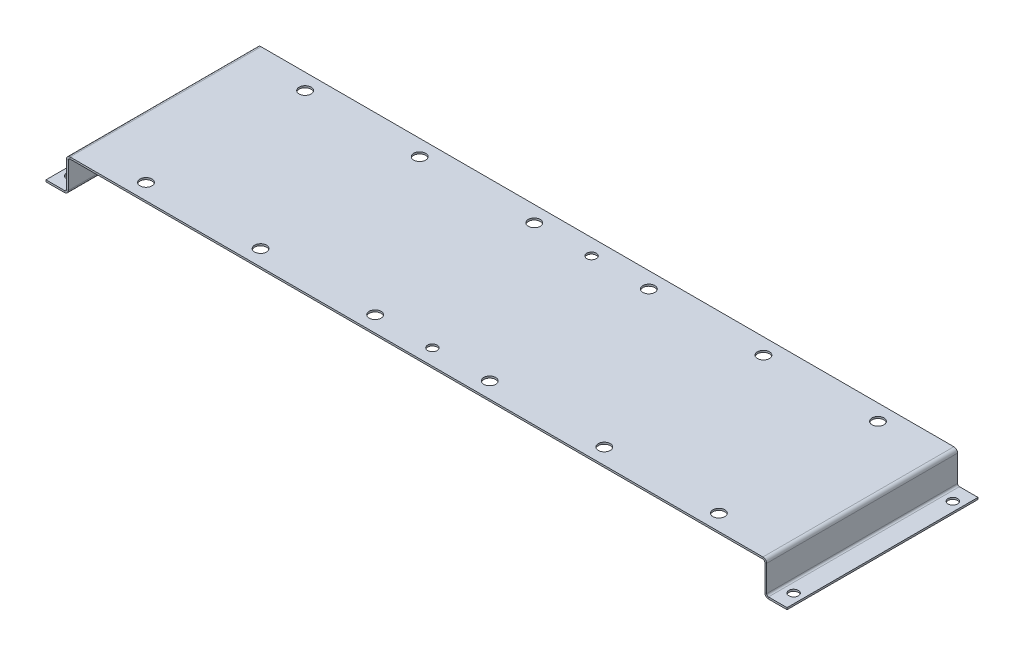
from build123d import *

# Parameters (mm, degrees)
SKETCH1_W                    = 279.4
SKETCH1_H                    = 76.2
BASE_FLANGE1_DEPTH           = 0.7366
EDGE_FLANGE1_STRIP_W         = 4.4196
EDGE_FLANGE1_STRIP_H         = 0.7366
EDGE_FLANGE1_STRIP_CUT_DEPTH = 76.2
EDGE_FLANGE1_DEPTH           = 76.2
EDGE_FLANGE2_DEPTH           = 76.2
F_6_CLEARANCE_HOLE1_D        = 3.7973
LPATTERN1_COUNT              = 6
LPATTERN1_PITCH              = 45.72
LPATTERN1_COUNT_DIR2         = 2
LPATTERN1_PITCH_DIR2         = 63.5
F_6_CLEARANCE_HOLE2_D        = 3.7973


# Sheet-metal steps are written as plain solids
with BuildPart() as part:
    # Sketch1 → Base-Flange1 (new body)
    with BuildSketch(Plane(origin=(0, 0, 0), x_dir=(1, 0, 0), z_dir=(0, 1, 0))):
        with Locations((139.7, 38.1)):
            Rectangle(SKETCH1_W, SKETCH1_H)
    extrude(amount=-BASE_FLANGE1_DEPTH)

    # Edge-Flange1 strip (across the edge) → Edge-Flange1 strip cut (cut)
    with BuildSketch(Plane(origin=(0, -0.7366, 0), x_dir=(1, 0, 0), z_dir=(0, 0, -1))):
        with Locations((-0.7366, -0.3683)):
            Rectangle(EDGE_FLANGE1_STRIP_W, EDGE_FLANGE1_STRIP_H)
    edge_flange1_strip_cut = extrude(amount=EDGE_FLANGE1_STRIP_CUT_DEPTH, mode=Mode.SUBTRACT)

    # Edge-Flange1 section (across the edge) → Edge-Flange1 (add)
    with BuildSketch(Plane(origin=(0, -0.7366, 0), x_dir=(1, 0, 0), z_dir=(0, 0, -1))):
        with BuildLine():
            Line((0, 0.7366), (0, 11.2268))
            Line((0, 11.2268), (0.7366, 11.2268))
            Line((0.7366, 11.2268), (0.7366, 0.7366))
            ThreePointArc((0.7366, 0.7366), (0.952345145, 0.215745145), (1.4732, 0))
            Line((1.4732, 0), (1.4732, -0.7366))
            ThreePointArc((1.4732, -0.7366), (0.43149029, -0.30510971), (0, 0.7366))
        make_face()
    edge_flange1 = extrude(amount=EDGE_FLANGE1_DEPTH)

    # Edge-Flange2 section (across the edge) → Edge-Flange2 (add)
    with BuildSketch(Plane(origin=(0, -12.7, -76.2), x_dir=(0, 1, 0), z_dir=(0, 0, 1))):
        with BuildLine():
            Line((-0.7366, 0.7366), (-0.7366, 8.1534))
            Line((-0.7366, 8.1534), (0, 8.1534))
            Line((0, 8.1534), (0, 0.7366))
            ThreePointArc((0, 0.7366), (0.215745145, 0.215745145), (0.7366, 0))
            Line((0.7366, 0), (0.7366, -0.7366))
            ThreePointArc((0.7366, -0.7366), (-0.30510971, -0.30510971), (-0.7366, 0.7366))
        make_face()
    edge_flange2 = extrude(amount=EDGE_FLANGE2_DEPTH)

    # Sketch21 → 3/32 (0.09375) Diameter Hole1 (revolve, cut)
    with BuildSketch(Plane(origin=(25.4, 0, -69.85), x_dir=(0, 0, 1), z_dir=(1, 0, 0))):
        Polygon((0, 0), (0, 2.167399349), (2.38125, 0.7366), (2.38125, 0), align=None)
    f_3_32_0_09375_diameter_hole1 = revolve(axis=Axis((25.4, 6.35, -69.85), (0, -1, 0)), mode=Mode.SUBTRACT)

    # #6 Clearance Hole1 (through all)
    with Locations(Plane(origin=(0, -12.7, 0), x_dir=(1, 0, 0), z_dir=(0, 1, 0))):
        with Locations((-4.445, 69.85), (-4.445, 6.35)):
            f_6_clearance_hole1 = Hole(F_6_CLEARANCE_HOLE1_D / 2)

    # LPattern1: 3_32 _0.09375_ Diameter Hole1 6 × 2
    with Locations(*[(i * LPATTERN1_PITCH, 0, j * LPATTERN1_PITCH_DIR2) for i in range(LPATTERN1_COUNT) for j in range(LPATTERN1_COUNT_DIR2) if (i, j) != (0, 0)]):
        add(f_3_32_0_09375_diameter_hole1, mode=Mode.SUBTRACT)

    # Mirror2: Edge-Flange1 strip cut, Edge-Flange1, Edge-Flange2, #6 Clearance Hole1 across plane
    add(edge_flange1_strip_cut.mirror(Plane.ZY.offset(-139.7)), mode=Mode.SUBTRACT)
    add(edge_flange1.mirror(Plane.ZY.offset(-139.7)))
    add(edge_flange2.mirror(Plane.ZY.offset(-139.7)))
    add(f_6_clearance_hole1.mirror(Plane.ZY.offset(-139.7)), mode=Mode.SUBTRACT)

    # #6 Clearance Hole2 (through all)
    with Locations(Plane(origin=(0, 0, 0), x_dir=(1, 0, 0), z_dir=(0, 1, 0))):
        with Locations((139.7, 69.85), (139.7, 6.35)):
            Hole(F_6_CLEARANCE_HOLE2_D / 2)


solid = part.part
